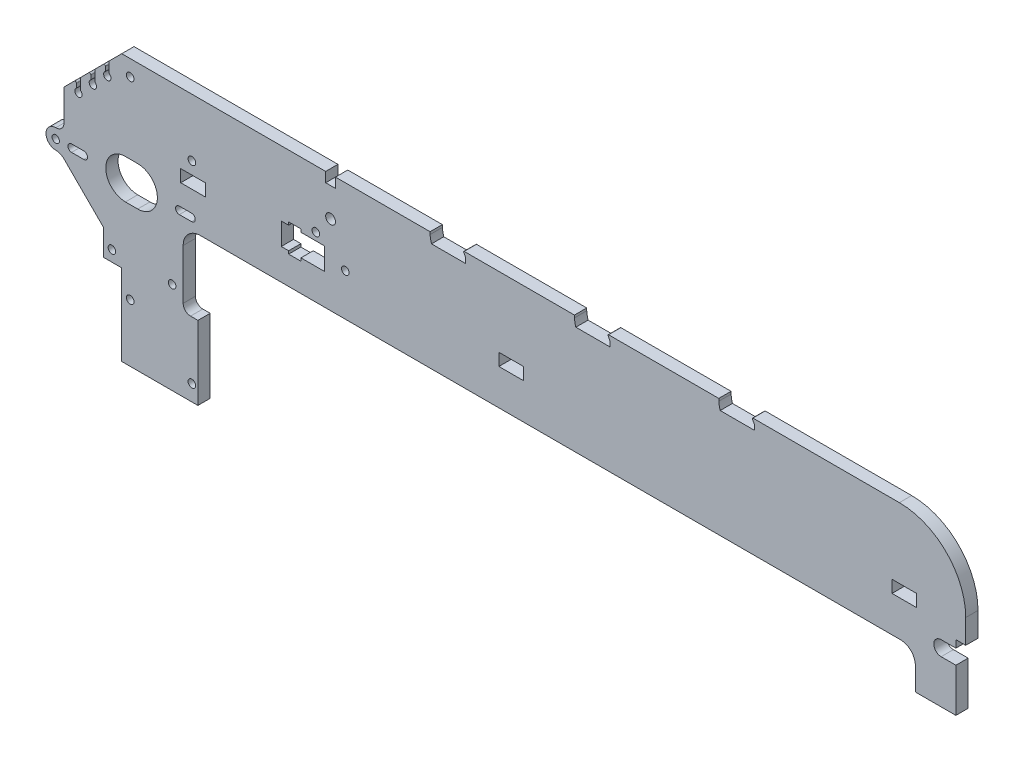
from build123d import *

# Parameters (mm, degrees)
SKETCH1_R           = 1.5
SKETCH1_R_2         = 8
SKETCH1_R_3         = 1.55
SKETCH1_R_4         = 2
SKETCH1_W           = 10
SKETCH1_H           = 5
BOSS_EXTRUDE1_DEPTH = 5
FILLET2_R           = 7
FILLET3_R           = 3
CUT_EXTRUDE1_DEPTH  = 344.247723955
FILLET4_R           = 6
CUT_EXTRUDE2_DEPTH  = 344.247723955
FILLET5_R           = 0.5


with BuildPart() as part:
    # Sketch1 → Boss-Extrude1 (new body)
    with BuildSketch(Plane.XY):
        with BuildLine():
            Line((310, 43.5), (250.404508497, 43.5))
            ThreePointArc((250.404508497, 43.5), (250.191845795, 43.381432778), (250.180901699, 43.138196601))
            Line((250.180901699, 43.138196601), (251, 41.5))
            Line((251, 41.5), (251, 39.5))
            Line((251, 39.5), (237.067482844, 39.5))
            ThreePointArc((237.067482844, 39.5), (236.698891369, 40.983949684), (236.5, 42.5))
            Line((236.5, 42.5), (236.5, 43.5))
            Line((236.5, 43.5), (191.654508497, 43.5))
            ThreePointArc((191.654508497, 43.5), (191.441845795, 43.381432778), (191.430901699, 43.138196601))
            Line((191.430901699, 43.138196601), (192.25, 41.5))
            Line((192.25, 41.5), (192.25, 39.5))
            Line((192.25, 39.5), (178.317482844, 39.5))
            ThreePointArc((178.317482844, 39.5), (177.948891369, 40.983949684), (177.75, 42.5))
            Line((177.75, 42.5), (177.75, 43.5))
            Line((177.75, 43.5), (132.904508497, 43.5))
            ThreePointArc((132.904508497, 43.5), (132.691845795, 43.381432778), (132.680901699, 43.138196601))
            Line((132.680901699, 43.138196601), (133.5, 41.5))
            Line((133.5, 41.5), (133.5, 39.5))
            Line((133.5, 39.5), (119.567482844, 39.5))
            ThreePointArc((119.567482844, 39.5), (119.198891369, 40.983949684), (119, 42.5))
            Line((119, 42.5), (119, 43.5))
            Line((119, 43.5), (80.5, 43.5))
            Line((80.5, 43.5), (80.5, 39.5))
            Line((80.5, 39.5), (76.5, 39.5))
            Line((76.5, 39.5), (76.5, 43.5))
            Line((76.5, 43.5), (-6.5, 43.5))
            Line((-6.5, 43.5), (-30, 20))
            Line((-30, 20), (-30, 7.325414703))
            ThreePointArc((-30, 7.325414703), (-30.985037822, 4.947323034), (-33.36312949, 3.962285212))
            ThreePointArc((-33.36312949, 3.962285212), (-37.325414703, 0), (-33.36312949, -3.962285212))
            ThreePointArc((-33.36312949, -3.962285212), (-31.543016926, -4.324328111), (-30, -5.355339059))
            Line((-30, -5.355339059), (-14, -21.355339059))
            Line((-14, -21.355339059), (-14, -32))
            Line((-14, -32), (-6.5, -32))
            Line((-6.5, -32), (-6.5, -65))
            Line((-6.5, -65), (24.5, -65))
            Line((24.5, -65), (24.5, -35))
            Line((24.5, -35), (18.5, -35))
            Line((18.5, -35), (18.5, -4.6))
            Line((18.5, -4.6), (316.5, -4.6))
            Line((316.5, -4.6), (316.5, -20))
            Line((316.5, -20), (333, -20))
            Line((333, -20), (333, -2.3))
            Line((333, -2.3), (327, -2.3))
            ThreePointArc((327, -2.3), (324, 0.7), (327, 3.7))
            Line((327, 3.7), (333, 3.7))
            Line((333, 3.7), (333, 6.7))
            Line((333, 6.7), (337, 6.7))
            Line((337, 6.7), (337, 16.5))
            ThreePointArc((337, 16.5), (329.091883092, 35.591883092), (310, 43.5))
        make_face()
        with Locations((21.920310217, 0)):
            Circle(SKETCH1_R, mode=Mode.SUBTRACT)
        with Locations((-21.920310217, 0)):
            Circle(SKETCH1_R, mode=Mode.SUBTRACT)
        Circle(SKETCH1_R_2, mode=Mode.SUBTRACT)
        with Locations((-3.05, 37)):
            Circle(SKETCH1_R_3, mode=Mode.SUBTRACT)
        with Locations((22.05, 20)):
            Circle(SKETCH1_R_3, mode=Mode.SUBTRACT)
        with Locations((-3.05, -41.5)):
            Circle(SKETCH1_R_3, mode=Mode.SUBTRACT)
        with Locations((22.05, -58.5)):
            Circle(SKETCH1_R_3, mode=Mode.SUBTRACT)
        with Locations((72.5, 20.1)):
            Circle(SKETCH1_R_3, mode=Mode.SUBTRACT)
        with Locations((84.5, 12.5)):
            Circle(SKETCH1_R_3, mode=Mode.SUBTRACT)
        with Locations((-10.5, -27.55)):
            Circle(SKETCH1_R_3, mode=Mode.SUBTRACT)
        with Locations((14, -27.55)):
            Circle(SKETCH1_R_3, mode=Mode.SUBTRACT)
        with Locations((-33.36312949, 0)):
            Circle(SKETCH1_R, mode=Mode.SUBTRACT)
        with Locations((78.5, 27.751425951)):
            Circle(SKETCH1_R_4, mode=Mode.SUBTRACT)
        with Locations((22.5, 12.5)):
            Rectangle(SKETCH1_W, SKETCH1_H, mode=Mode.SUBTRACT)
        with Locations((152, 12.5)):
            Rectangle(SKETCH1_W, SKETCH1_H, mode=Mode.SUBTRACT)
        with Locations((312, 12.5)):
            Rectangle(SKETCH1_W, SKETCH1_H, mode=Mode.SUBTRACT)
        Polygon((58.427680349, 8), (61.427680349, 8), (61.427680349, 6.806102344), (66.427680349, 6.806102344), (66.427680349, 8), (76, 8), (76, 17), (66.427680349, 17), (66.427680349, 18.193897656), (61.427680349, 18.193897656), (61.427680349, 17), (58.427680349, 17), align=None, mode=Mode.SUBTRACT)
    extrude(amount=BOSS_EXTRUDE1_DEPTH)

    # Fillet2
    fillet2_edges = [part.edges().sort_by_distance(p)[0] for p in [
        (18.5, -4.6, 2.5),
    ]]
    fillet(fillet2_edges, radius=FILLET2_R)

    # Fillet3
    fillet3_edges = [part.edges().sort_by_distance(p)[0] for p in [
        (18.5, -35, 2.5),
    ]]
    fillet(fillet3_edges, radius=FILLET3_R)

    # Sketch2 → Cut-Extrude1 (cut, through all)
    with BuildSketch(Plane.XY.offset(5)):
        with BuildLine():
            Line((21.920310217, -1.5), (16.920310217, -1.5))
            ThreePointArc((16.920310217, -1.5), (15.420310217, 0), (16.920310217, 1.5))
            Line((16.920310217, 1.5), (21.920310217, 1.5))
            ThreePointArc((21.920310217, 1.5), (23.420310217, 0), (21.920310217, -1.5))
        make_face()
        with BuildLine():
            Line((0, -8), (-5, -8))
            ThreePointArc((-5, -8), (-13, 0), (-5, 8))
            Line((-5, 8), (0, 8))
            ThreePointArc((0, 8), (8, 0), (0, -8))
        make_face()
        with BuildLine():
            Line((-21.920310217, -1.5), (-26.920310217, -1.5))
            ThreePointArc((-26.920310217, -1.5), (-28.420310217, 0), (-26.920310217, 1.5))
            Line((-26.920310217, 1.5), (-21.920310217, 1.5))
            ThreePointArc((-21.920310217, 1.5), (-20.420310217, 0), (-21.920310217, -1.5))
        make_face()
    extrude(amount=-CUT_EXTRUDE1_DEPTH, mode=Mode.SUBTRACT)

    # Fillet4
    fillet4_edges = [part.edges().sort_by_distance(p)[0] for p in [
        (316.5, -4.6, 2.5),
    ]]
    fillet(fillet4_edges, radius=FILLET4_R)

    # Sketch3 → Cut-Extrude2 (cut, through all)
    with BuildSketch(Plane.XY.offset(5)):
        with BuildLine():
            Line((-13.125, 42.835857073), (-11.625, 42.835857073))
            Line((-11.625, 42.835857073), (-11.625, 33.924038106))
            ThreePointArc((-11.625, 33.924038106), (-12.375, 31.125), (-13.125, 33.924038106))
            Line((-13.125, 33.924038106), (-13.125, 42.835857073))
        make_face()
        with BuildLine():
            Line((-17.4, 36.92183731), (-17.4, 27.985920709))
            ThreePointArc((-17.4, 27.985920709), (-18.25, 25.25), (-19.1, 27.985920709))
            Line((-19.1, 27.985920709), (-19.1, 36.92183731))
            Line((-19.1, 36.92183731), (-17.4, 36.92183731))
        make_face()
        with BuildLine():
            Line((-23.275, 31.04683731), (-23.275, 22.110920709))
            ThreePointArc((-23.275, 22.110920709), (-24.125, 19.375), (-24.975, 22.110920709))
            Line((-24.975, 22.110920709), (-24.975, 31.04683731))
            Line((-24.975, 31.04683731), (-23.275, 31.04683731))
        make_face()
    extrude(amount=-CUT_EXTRUDE2_DEPTH, mode=Mode.SUBTRACT)

    # Fillet5
    fillet5_edges = [part.edges().sort_by_distance(p)[0] for p in [
        (-24.975, 25.025, 2.5),
        (-19.1, 30.9, 2.5),
        (-13.125, 36.875, 2.5),
    ]]
    fillet(fillet5_edges, radius=FILLET5_R)


solid = part.part
